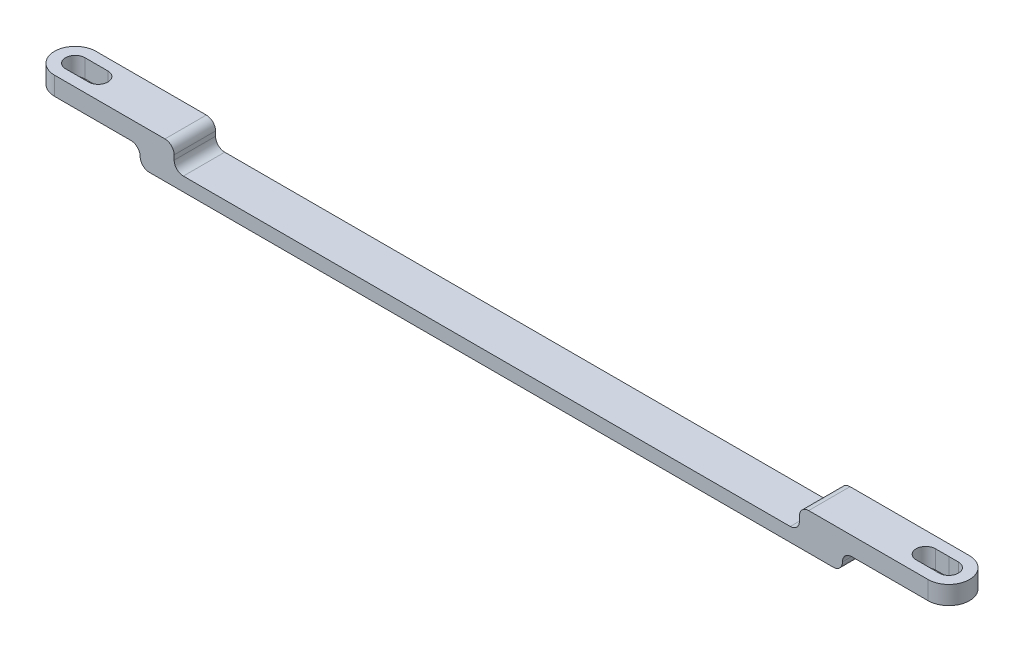
from build123d import *
from OCP.BRepAlgoAPI import BRepAlgoAPI_Cut
from OCP.TopTools import TopTools_ListOfShape

# Parameters (mm, degrees)
BOSS_EXTRUDE1_DEPTH = 4
SKETCH2_W           = 152.748685894
SKETCH2_H           = 9
BOSS_EXTRUDE2_DEPTH = 4
SKETCH4_W           = 136
SKETCH4_H           = 8.999998789
CUT_EXTRUDE1_DEPTH  = 5
FILLET1_R           = 2


with BuildPart() as part:
    # Sketch1 → Boss-Extrude1 (new body)
    with BuildSketch(Plane(origin=(0, 0, 0), x_dir=(1, 0, 0), z_dir=(0, 1, 0))):
        with BuildLine():
            Line((177.196729435, 4.499999466), (2.799999668, 4.499999466))
            Line((2.799999668, 4.499999466), (-5, 4.499999466))
            ThreePointArc((-5, 4.499999466), (-9.499999466, 0), (-5, -4.499999466))
            Line((-5, -4.499999466), (2.799999668, -4.499999466))
            Line((2.799999668, -4.499999466), (177.196729435, -4.499999466))
            Line((177.196729435, -4.499999466), (184.999999457, -4.499999466))
            ThreePointArc((184.999999457, -4.499999466), (189.499998923, 0), (184.999999457, 4.499999466))
            Line((184.999999457, 4.499999466), (177.196729435, 4.499999466))
        make_face()
        with BuildLine():
            ThreePointArc((-5, -2.099999371), (-7.099999371, 0), (-5, 2.099999371))
            Line((-5, 2.099999371), (0, 2.099999371))
            ThreePointArc((0, 2.099999371), (2.099999371, 0), (0, -2.099999371))
            Line((0, -2.099999371), (-5, -2.099999371))
        make_face(mode=Mode.SUBTRACT)
        with BuildLine():
            ThreePointArc((179.999998561, -2.09827259), (177.90172597, 0), (179.999998561, 2.09827259))
            Line((179.999998561, 2.09827259), (182.917630381, 2.09827259))
            Line((182.917630381, 2.09827259), (182.925849231, 2.107751903))
            ThreePointArc((182.925849231, 2.107751903), (182.928357501, 2.103013739), (182.930860124, 2.09827259))
            Line((182.930860124, 2.09827259), (184.999999457, 2.09827259))
            ThreePointArc((184.999999457, 2.09827259), (187.098272047, 0), (184.999999457, -2.09827259))
            Line((184.999999457, -2.09827259), (179.999998561, -2.09827259))
        make_face(mode=Mode.SUBTRACT)
    extrude(amount=BOSS_EXTRUDE1_DEPTH)

    # Sketch2 → Boss-Extrude2 (add)
    with BuildSketch(Plane.XZ):
        with Locations((90, -5.34e-07)):
            Rectangle(SKETCH2_W, SKETCH2_H)
    extrude(amount=BOSS_EXTRUDE2_DEPTH)


with BuildPart() as cut_extrude1_tool:
    # Sketch4 → Cut-Extrude1 (new body)
    with BuildSketch(Plane(origin=(0, 4, 0), x_dir=(1, 0, 0), z_dir=(0, 1, 0))):
        with Locations((89.020897584, -6.05e-07)):
            Rectangle(SKETCH4_W, SKETCH4_H)
    extrude(amount=-CUT_EXTRUDE1_DEPTH)


with BuildPart() as part_1:
    add(part.part)

    # Cut-Extrude1: cut by cut_extrude1_tool, with a tolerance
    cut_extrude1_stock = TopTools_ListOfShape()
    cut_extrude1_stock.Append(part_1.part.wrapped)
    cut_extrude1_tools = TopTools_ListOfShape()
    cut_extrude1_tools.Append(cut_extrude1_tool.part.wrapped)
    cut_extrude1_cut = BRepAlgoAPI_Cut()
    cut_extrude1_cut.SetArguments(cut_extrude1_stock)
    cut_extrude1_cut.SetTools(cut_extrude1_tools)
    cut_extrude1_cut.SetFuzzyValue(0.00001)
    cut_extrude1_cut.Build()
    add(Compound.cast(cut_extrude1_cut.Shape()).solids(), mode=Mode.REPLACE)

    # Fillet1
    # the kernel refuses this fillet: 2 mm, written as the material it adds along each edge
    with BuildSketch(Plane(origin=(157.020897584, -1, 9.5), x_dir=(0, 1, 0), z_dir=(0, 0, -1))) as fillet1_piece_1_section:
        with BuildLine():
            CenterArc((FILLET1_R, -FILLET1_R), FILLET1_R, 90, 90)
            Line((0, -FILLET1_R), (0, 0))
            Line((0, 0), (FILLET1_R, 0))
        make_face()
    fillet1_piece_1 = extrude(amount=18.999998789, mode=Mode.PRIVATE)
    fillet1_piece_1 = split(fillet1_piece_1, bisect_by=Plane(origin=(157.020897584, -1, 4.499999466), z_dir=(0, 0, -1)), keep=Keep.TOP, mode=Mode.PRIVATE)
    fillet1_piece_1 = split(fillet1_piece_1, bisect_by=Plane(origin=(157.020897584, -1, -4.500000534), z_dir=(0, 0, 1)), keep=Keep.TOP, mode=Mode.PRIVATE)
    add(fillet1_piece_1)
    with BuildSketch(Plane(origin=(21.020897584, -1, -9.499998789), x_dir=(1, 0, 0), z_dir=(0, 0, 1))) as fillet1_piece_2_section:
        with BuildLine():
            CenterArc((FILLET1_R, FILLET1_R), FILLET1_R, 180, 90)
            Line((0, FILLET1_R), (0, 0))
            Line((0, 0), (FILLET1_R, 0))
        make_face()
    fillet1_piece_2 = extrude(amount=18.999998789, mode=Mode.PRIVATE)
    fillet1_piece_2 = split(fillet1_piece_2, bisect_by=Plane(origin=(21.020897584, -1, 4.499999466), z_dir=(0, 0, -1)), keep=Keep.TOP, mode=Mode.PRIVATE)
    fillet1_piece_2 = split(fillet1_piece_2, bisect_by=Plane(origin=(21.020897584, -1, -4.500000534), z_dir=(0, 0, 1)), keep=Keep.TOP, mode=Mode.PRIVATE)
    add(fillet1_piece_2)
    with BuildSketch(Plane(origin=(13.625657053, 0, 4.499999466), x_dir=(-1, 0, 0), z_dir=(0, 0, -1))) as fillet1_piece_3_section:
        with BuildLine():
            CenterArc((FILLET1_R, -FILLET1_R), FILLET1_R, 90, 90)
            Line((0, -FILLET1_R), (0, 0))
            Line((0, 0), (FILLET1_R, 0))
        make_face()
    fillet1_piece_3 = extrude(amount=13.999998931, mode=Mode.PRIVATE)
    fillet1_piece_3 = split(fillet1_piece_3, bisect_by=Plane(origin=(13.625657053, 0, -4.500000534), z_dir=(0, 0, 1)), keep=Keep.TOP, mode=Mode.PRIVATE)
    add(fillet1_piece_3)
    with BuildSketch(Plane(origin=(166.374342947, 0, -9.499999466), x_dir=(1, 0, 0), z_dir=(0, 0, 1))) as fillet1_piece_4_section:
        with BuildLine():
            CenterArc((FILLET1_R, -FILLET1_R), FILLET1_R, 90, 90)
            Line((0, -FILLET1_R), (0, 0))
            Line((0, 0), (FILLET1_R, 0))
        make_face()
    fillet1_piece_4 = extrude(amount=13.999998931, mode=Mode.PRIVATE)
    fillet1_piece_4 = split(fillet1_piece_4, bisect_by=Plane(origin=(166.374342947, 0, -4.500000534), z_dir=(0, 0, 1)), keep=Keep.TOP, mode=Mode.PRIVATE)
    add(fillet1_piece_4)
    # the kernel refuses this fillet: 2 mm, written as the material it takes off along each edge
    with BuildSketch(Plane(origin=(13.625657053, -4, 9.499999466), x_dir=(0, 1, 0), z_dir=(0, 0, -1))) as fillet1_2_piece_1:
        with BuildLine():
            CenterArc((FILLET1_R, FILLET1_R), FILLET1_R, 180, 90)
            Line((0, FILLET1_R), (0, 0))
            Line((0, 0), (FILLET1_R, 0))
        make_face()
    extrude(amount=19, mode=Mode.SUBTRACT)
    with BuildSketch(Plane(origin=(166.374342947, -4, -9.500000534), x_dir=(-1, 0, 0), z_dir=(0, 0, 1))) as fillet1_2_piece_2:
        with BuildLine():
            CenterArc((FILLET1_R, -FILLET1_R), FILLET1_R, 90, 90)
            Line((0, -FILLET1_R), (0, 0))
            Line((0, 0), (FILLET1_R, 0))
        make_face()
    extrude(amount=19, mode=Mode.SUBTRACT)
    with BuildSketch(Plane(origin=(21.020897584, 4, -9.499998789), x_dir=(0, -1, 0), z_dir=(0, 0, 1)), Plane(origin=(157.020897584, 4, 9.5), x_dir=(0, -1, 0), z_dir=(0, 0, -1))) as fillet1_2_piece_3:
        with BuildLine():
            CenterArc((FILLET1_R, -FILLET1_R), FILLET1_R, 90, 90)
            Line((0, -FILLET1_R), (0, 0))
            Line((0, 0), (FILLET1_R, 0))
        make_face()
    extrude(amount=18.999998789, mode=Mode.SUBTRACT)


solid = part_1.part
